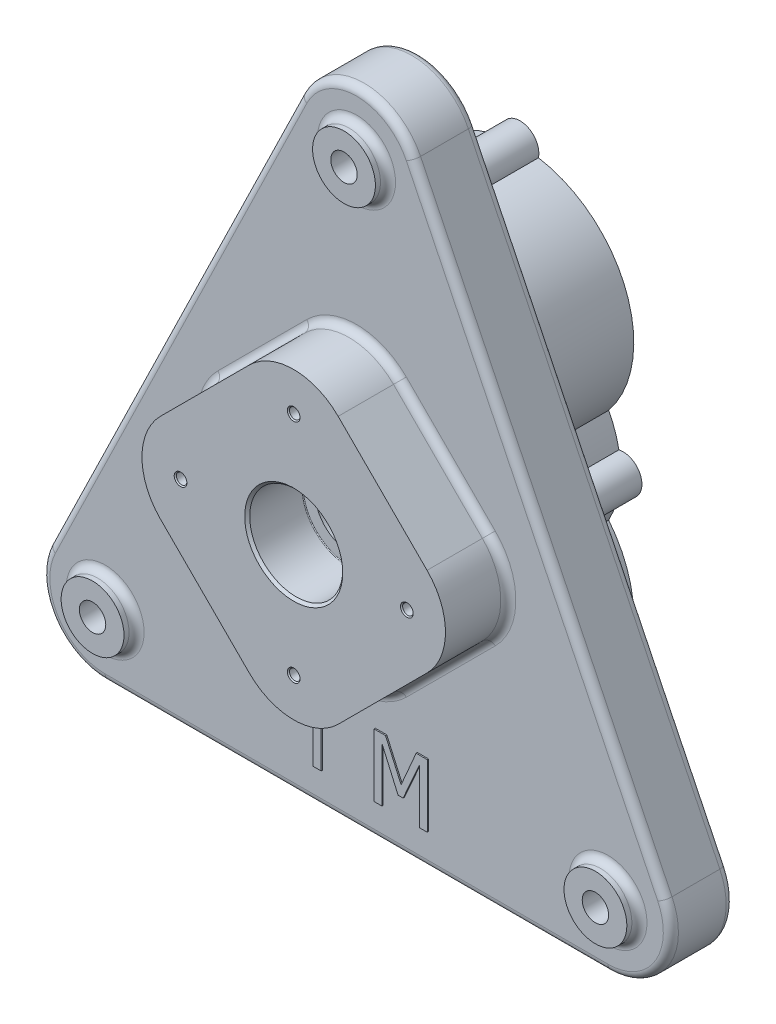
from build123d import *

# Parameters (mm, degrees)
SKETCH1_R                       = 12.5
SKETCH1_R_2                     = 13.5
SKETCH1_R_3                     = 5.25
BOSS_EXTRUDE1_DEPTH             = 25
SKETCH1_3_R                     = 13.5
BOSS_EXTRUDE2_DEPTH             = 50
BOSS_EXTRUDE4_DEPTH             = 40
BOSS_EXTRUDE5_DEPTH             = 35
CUT_EXTRUDE6_START              = -5
SKETCH2_7_R                     = 13.5
CUT_EXTRUDE6_DEPTH              = 5
SKETCH4_R                       = 12
CUT_EXTRUDE7_DEPTH              = 20
SKETCH4_5_R                     = 15
SKETCH4_5_R_2                   = 12
CUT_EXTRUDE8_DEPTH              = 18
SKETCH5_R                       = 18.5
CUT_EXTRUDE9_DEPTH              = 17
CUT_EXTRUDE10_START             = -23
SKETCH5_2_R                     = 18.5
CUT_EXTRUDE10_DEPTH             = 22
FILLET1_R                       = 3
M5X0_8_TAPPED_HOLE1_D           = 4.2
M5X0_8_TAPPED_HOLE1_DEPTH       = 13.7381927
M5X0_8_TAPPED_HOLE1_CSINK_D     = 5.05
M5X0_8_TAPPED_HOLE1_CSINK_ANGLE = 90
M5X0_8_TAPPED_HOLE1_TIP         = 1.2618073
M6X1_0_TAPPED_HOLE1_D           = 5
M6X1_0_TAPPED_HOLE1_DEPTH       = 20.497848452
M6X1_0_TAPPED_HOLE1_CSINK_D     = 6.05
M6X1_0_TAPPED_HOLE1_CSINK_ANGLE = 90
M6X1_0_TAPPED_HOLE1_TIP         = 1.502151548
FILLET3_R                       = 2
CHAMFER1_SIZE                   = 1
BOSS_EXTRUDE6_DEPTH             = 0.5
SKETCH11_R                      = 12.5
SKETCH11_R_2                    = 5.25
BOSS_EXTRUDE7_DEPTH             = 5
FILLET5_R                       = 3
SKETCH12_R                      = 12
CUT_EXTRUDE11_DEPTH             = 0.8
FILLET6_R                       = 3
FILLET7_R                       = 0.3
FILLET8_R                       = 0.3
CHAMFER3_SIZE                   = 1


with BuildPart() as part:
    # Sketch1 → Boss-Extrude1 (new body)
    # profile 1 of 5: a face of its own
    with BuildSketch(Plane.XY):
        with BuildLine():
            Line((-100, -110), (100, -110))
            ThreePointArc((100, -110), (121.201589209, -98.247362567), (122.469211141, -74.039409199))
            Line((122.469211141, -74.039409199), (22.469211141, 130.960590801))
            ThreePointArc((22.469211141, 130.960590801), (0, 145), (-22.469211141, 130.960590801))
            Line((-22.469211141, 130.960590801), (-122.469211141, -74.039409199))
            ThreePointArc((-122.469211141, -74.039409199), (-121.201589209, -98.247362567), (-100, -110))
        make_face()
        with Locations((100, -85)):
            Circle(SKETCH1_R, mode=Mode.SUBTRACT)
        with Locations((-100, -85)):
            Circle(SKETCH1_R, mode=Mode.SUBTRACT)
        with Locations((0, 120)):
            Circle(SKETCH1_R, mode=Mode.SUBTRACT)
        with BuildLine():
            ThreePointArc((17.67766953, 53.033008589), (0, 60.355339059), (-17.67766953, 53.033008589))
            Line((-17.67766953, 53.033008589), (-53.033008589, 17.67766953))
            ThreePointArc((-53.033008589, 17.67766953), (-60.355339059, 0), (-53.033008589, -17.67766953))
            Line((-53.033008589, -17.67766953), (-17.67766953, -53.033008589))
            ThreePointArc((-17.67766953, -53.033008589), (0, -60.355339059), (17.67766953, -53.033008589))
            Line((17.67766953, -53.033008589), (53.033008589, -17.67766953))
            ThreePointArc((53.033008589, -17.67766953), (60.355339059, 0), (53.033008589, 17.67766953))
            Line((53.033008589, 17.67766953), (17.67766953, 53.033008589))
        make_face(mode=Mode.SUBTRACT)
    # profile 2 of 5: a face of its own
    with BuildSketch(Plane.XY):
        with BuildLine():
            Line((53.033008589, 17.67766953), (17.67766953, 53.033008589))
            ThreePointArc((17.67766953, 53.033008589), (0, 60.355339059), (-17.67766953, 53.033008589))
            Line((-17.67766953, 53.033008589), (-53.033008589, 17.67766953))
            ThreePointArc((-53.033008589, 17.67766953), (-60.355339059, 0), (-53.033008589, -17.67766953))
            Line((-53.033008589, -17.67766953), (-17.67766953, -53.033008589))
            ThreePointArc((-17.67766953, -53.033008589), (0, -60.355339059), (17.67766953, -53.033008589))
            Line((17.67766953, -53.033008589), (53.033008589, -17.67766953))
            ThreePointArc((53.033008589, -17.67766953), (60.355339059, 0), (53.033008589, 17.67766953))
        make_face()
        Circle(SKETCH1_R_2, mode=Mode.SUBTRACT)
    # profile 3 of 5: a face of its own
    with BuildSketch(Plane.XY):
        with Locations((100, -85)):
            Circle(SKETCH1_R)
        with Locations((100, -85)):
            Circle(SKETCH1_R_3, mode=Mode.SUBTRACT)
    # profile 4 of 5: a face of its own
    with BuildSketch(Plane.XY):
        with Locations((0, 120)):
            Circle(SKETCH1_R)
        with Locations((0, 120)):
            Circle(SKETCH1_R_3, mode=Mode.SUBTRACT)
    # profile 5 of 5: a face of its own
    with BuildSketch(Plane.XY):
        with Locations((-100, -85)):
            Circle(SKETCH1_R)
        with Locations((-100, -85)):
            Circle(SKETCH1_R_3, mode=Mode.SUBTRACT)
    extrude(amount=BOSS_EXTRUDE1_DEPTH)

    # Sketch1<3> → Boss-Extrude2 (add)
    with BuildSketch(Plane.XY):
        with BuildLine():
            Line((53.033008589, 17.67766953), (17.67766953, 53.033008589))
            ThreePointArc((17.67766953, 53.033008589), (0, 60.355339059), (-17.67766953, 53.033008589))
            Line((-17.67766953, 53.033008589), (-53.033008589, 17.67766953))
            ThreePointArc((-53.033008589, 17.67766953), (-60.355339059, 0), (-53.033008589, -17.67766953))
            Line((-53.033008589, -17.67766953), (-17.67766953, -53.033008589))
            ThreePointArc((-17.67766953, -53.033008589), (0, -60.355339059), (17.67766953, -53.033008589))
            Line((17.67766953, -53.033008589), (53.033008589, -17.67766953))
            ThreePointArc((53.033008589, -17.67766953), (60.355339059, 0), (53.033008589, 17.67766953))
        make_face()
        Circle(SKETCH1_3_R, mode=Mode.SUBTRACT)
    extrude(amount=BOSS_EXTRUDE2_DEPTH)

    # Sketch2 → Boss-Extrude4 (add)
    with BuildSketch(Plane(origin=(0, 0, 0), x_dir=(-1, 0, 0), z_dir=(0, 0, -1))):
        with BuildLine():
            ThreePointArc((39.326219512, 7.310845292), (48.5, 0), (39.326219512, -7.310845292))
            ThreePointArc((39.326219512, -7.310845292), (37.73934661, -13.256761197), (35.25918145, -18.888888889))
            ThreePointArc((35.25918145, -18.888888889), (42.263103155, -63.417640882), (7.327935681, -91.902702703))
            ThreePointArc((7.327935681, -91.902702703), (0, -101), (-7.327935681, -91.902702703))
            ThreePointArc((-7.327935681, -91.902702703), (-42.263103155, -63.417640882), (-35.25918145, -18.888888889))
            ThreePointArc((-35.25918145, -18.888888889), (-37.73934661, -13.256761197), (-39.326219512, -7.310845292))
            ThreePointArc((-39.326219512, -7.310845292), (-48.5, 0), (-39.326219512, 7.310845292))
            ThreePointArc((-39.326219512, 7.310845292), (-37.73934661, 13.256761197), (-35.25918145, 18.888888889))
            ThreePointArc((-35.25918145, 18.888888889), (-42.263103155, 63.417640882), (-7.327935681, 91.902702703))
            ThreePointArc((-7.327935681, 91.902702703), (0, 101), (7.327935681, 91.902702703))
            ThreePointArc((7.327935681, 91.902702703), (42.263103155, 63.417640882), (35.25918145, 18.888888889))
            ThreePointArc((35.25918145, 18.888888889), (37.73934661, 13.256761197), (39.326219512, 7.310845292))
        make_face()
        with BuildLine():
            ThreePointArc((-33.634026941, 25.14084507), (-31.560284169, 19.279235577), (-32.445868381, 13.125))
            ThreePointArc((-32.445868381, 13.125), (-35, 0), (-32.445868381, -13.125))
            ThreePointArc((-32.445868381, -13.125), (-31.560284169, -19.279235577), (-33.634026941, -25.14084507))
            ThreePointArc((-33.634026941, -25.14084507), (0, -87.5), (33.634026941, -25.14084507))
            ThreePointArc((33.634026941, -25.14084507), (31.560284169, -19.279235577), (32.445868381, -13.125))
            ThreePointArc((32.445868381, -13.125), (35, 0), (32.445868381, 13.125))
            ThreePointArc((32.445868381, 13.125), (31.560284169, 19.279235577), (33.634026941, 25.14084507))
            ThreePointArc((33.634026941, 25.14084507), (0, 87.5), (-33.634026941, 25.14084507))
        make_face(mode=Mode.SUBTRACT)
    extrude(amount=BOSS_EXTRUDE4_DEPTH)

    # Sketch2<6> → Boss-Extrude5 (add)
    with BuildSketch(Plane(origin=(0, 0, 0), x_dir=(-1, 0, 0), z_dir=(0, 0, -1))):
        with BuildLine():
            ThreePointArc((33.634026941, 25.14084507), (0, 87.5), (-33.634026941, 25.14084507))
            ThreePointArc((-33.634026941, 25.14084507), (-31.560284169, 19.279235577), (-32.445868381, 13.125))
            ThreePointArc((-32.445868381, 13.125), (-35, 0), (-32.445868381, -13.125))
            ThreePointArc((-32.445868381, -13.125), (-31.560284169, -19.279235577), (-33.634026941, -25.14084507))
            ThreePointArc((-33.634026941, -25.14084507), (0, -87.5), (33.634026941, -25.14084507))
            ThreePointArc((33.634026941, -25.14084507), (31.560284169, -19.279235577), (32.445868381, -13.125))
            ThreePointArc((32.445868381, -13.125), (35, 0), (32.445868381, 13.125))
            ThreePointArc((32.445868381, 13.125), (31.560284169, 19.279235577), (33.634026941, 25.14084507))
        make_face()
        with BuildLine():
            ThreePointArc((-29.402979588, 26.047941342), (-27.007468125, 19.69170868), (-28.144827014, 12.994949495))
            ThreePointArc((-28.144827014, 12.994949495), (-31, 0), (-28.144827014, -12.994949495))
            ThreePointArc((-28.144827014, -12.994949495), (-27.007468125, -19.69170868), (-29.402979588, -26.047941342))
            ThreePointArc((-29.402979588, -26.047941342), (0, -83.5), (29.402979588, -26.047941342))
            ThreePointArc((29.402979588, -26.047941342), (27.007468125, -19.69170868), (28.144827014, -12.994949495))
            ThreePointArc((28.144827014, -12.994949495), (31, 0), (28.144827014, 12.994949495))
            ThreePointArc((28.144827014, 12.994949495), (27.007468125, 19.69170868), (29.402979588, 26.047941342))
            ThreePointArc((29.402979588, 26.047941342), (0, 83.5), (-29.402979588, 26.047941342))
        make_face(mode=Mode.SUBTRACT)
    extrude(amount=BOSS_EXTRUDE5_DEPTH)

    # Sketch2<7> → Cut-Extrude6 (cut)
    with BuildSketch(Plane(origin=(0, 0, 0), x_dir=(-1, 0, 0), z_dir=(0, 0, -1)).offset(CUT_EXTRUDE6_START)):
        with BuildLine():
            ThreePointArc((29.402979588, 26.047941342), (0, 83.5), (-29.402979588, 26.047941342))
            ThreePointArc((-29.402979588, 26.047941342), (-27.007468125, 19.69170868), (-28.144827014, 12.994949495))
            ThreePointArc((-28.144827014, 12.994949495), (-31, 0), (-28.144827014, -12.994949495))
            ThreePointArc((-28.144827014, -12.994949495), (-27.007468125, -19.69170868), (-29.402979588, -26.047941342))
            ThreePointArc((-29.402979588, -26.047941342), (0, -83.5), (29.402979588, -26.047941342))
            ThreePointArc((29.402979588, -26.047941342), (27.007468125, -19.69170868), (28.144827014, -12.994949495))
            ThreePointArc((28.144827014, -12.994949495), (31, 0), (28.144827014, 12.994949495))
            ThreePointArc((28.144827014, 12.994949495), (27.007468125, 19.69170868), (29.402979588, 26.047941342))
        make_face()
        Circle(SKETCH2_7_R, mode=Mode.SUBTRACT)
    extrude(amount=CUT_EXTRUDE6_DEPTH, mode=Mode.SUBTRACT)

    # Sketch4 → Cut-Extrude7 (cut)
    with BuildSketch(Plane(origin=(0, 0, 0), x_dir=(-1, 0, 0), z_dir=(0, 0, -1))):
        with Locations((0, -47.25)):
            Circle(SKETCH4_R)
        with Locations((0, 47.25)):
            Circle(SKETCH4_R)
    extrude(amount=-CUT_EXTRUDE7_DEPTH, mode=Mode.SUBTRACT)

    # Sketch4<5> → Cut-Extrude8 (cut)
    # profile 1 of 2: a face of its own
    with BuildSketch(Plane(origin=(0, 0, 0), x_dir=(-1, 0, 0), z_dir=(0, 0, -1))):
        with Locations((0, 47.25)):
            Circle(SKETCH4_5_R)
        with Locations((0, 47.25)):
            Circle(SKETCH4_5_R_2, mode=Mode.SUBTRACT)
    # profile 2 of 2: a face of its own
    with BuildSketch(Plane(origin=(0, 0, 0), x_dir=(-1, 0, 0), z_dir=(0, 0, -1))):
        with Locations((0, -47.25)):
            Circle(SKETCH4_5_R)
        with Locations((0, -47.25)):
            Circle(SKETCH4_5_R_2, mode=Mode.SUBTRACT)
    extrude(amount=-CUT_EXTRUDE8_DEPTH, mode=Mode.SUBTRACT)

    # Sketch5 → Cut-Extrude9 (cut)
    with BuildSketch(Plane(origin=(0, 0, 5), x_dir=(-1, 0, 0), z_dir=(0, 0, -1))):
        Circle(SKETCH5_R)
    extrude(amount=-CUT_EXTRUDE9_DEPTH, mode=Mode.SUBTRACT)

    # Sketch5<2> → Cut-Extrude10 (cut)
    with BuildSketch(Plane(origin=(0, 0, 5), x_dir=(-1, 0, 0), z_dir=(0, 0, -1)).offset(CUT_EXTRUDE10_START)):
        Circle(SKETCH5_2_R)
    extrude(amount=-CUT_EXTRUDE10_DEPTH, mode=Mode.SUBTRACT)

    # Fillet1
    fillet1_edges = [part.edges().sort_by_distance(p)[0] for p in [
        (121.201589209, -98.247362567, 25),
        (-121.201589209, -98.247362567, 0),
        (-72.469211141, 28.460590801, 0),
        (0, 145, 0),
        (72.469211141, 28.460590801, 0),
        (121.201589209, -98.247362567, 0),
        (0, -110, 0),
        (0, 83.5, 5),
        (-31, 0, 5),
        (-27.007468125, -19.69170868, 5),
        (31, 0, 5),
        (27.007468125, 19.69170868, 5),
        (-27.007468125, 19.69170868, 5),
        (0, -83.5, 5),
        (27.007468125, -19.69170868, 5),
        (72.469211141, 28.460590801, 25),
        (0, 145, 25),
        (-72.469211141, 28.460590801, 25),
        (-121.201589209, -98.247362567, 25),
        (35.355339059, 35.355339059, 25),
        (0, 60.355339059, 25),
        (-35.355339059, 35.355339059, 25),
        (-60.355339059, 0, 25),
        (-35.355339059, -35.355339059, 25),
        (0, -60.355339059, 25),
        (35.355339059, -35.355339059, 25),
        (60.355339059, 0, 25),
        (0, -110, 25),
    ]]
    fillet(fillet1_edges, radius=FILLET1_R)

    # M5x0.8 Tapped Hole1
    with Locations(Plane(origin=(0, 45, 50), x_dir=(1, 0, 0), z_dir=(0, 0, 1))):
        with Locations((0, 0), (-45, -45), (45, -45), (0, -90)):
            CounterSinkHole(M5X0_8_TAPPED_HOLE1_D / 2, M5X0_8_TAPPED_HOLE1_CSINK_D / 2, depth=M5X0_8_TAPPED_HOLE1_DEPTH, counter_sink_angle=M5X0_8_TAPPED_HOLE1_CSINK_ANGLE)
            with Locations((0, 0, -(M5X0_8_TAPPED_HOLE1_DEPTH + M5X0_8_TAPPED_HOLE1_TIP / 2))):  # 118° drill point
                Cone(0, M5X0_8_TAPPED_HOLE1_D / 2, M5X0_8_TAPPED_HOLE1_TIP, mode=Mode.SUBTRACT)

    # M6x1.0 Tapped Hole1
    with Locations(Plane(origin=(0, 93.5, -40), x_dir=(-1, 0, 0), z_dir=(0, 0, -1))):
        with Locations((0, 0), (41, -93.5), (-41, -93.5), (0, -187)):
            CounterSinkHole(M6X1_0_TAPPED_HOLE1_D / 2, M6X1_0_TAPPED_HOLE1_CSINK_D / 2, depth=M6X1_0_TAPPED_HOLE1_DEPTH, counter_sink_angle=M6X1_0_TAPPED_HOLE1_CSINK_ANGLE)
            with Locations((0, 0, -(M6X1_0_TAPPED_HOLE1_DEPTH + M6X1_0_TAPPED_HOLE1_TIP / 2))):  # 118° drill point
                Cone(0, M6X1_0_TAPPED_HOLE1_D / 2, M6X1_0_TAPPED_HOLE1_TIP, mode=Mode.SUBTRACT)

    # Fillet3
    fillet3_edges = [part.edges().sort_by_distance(p)[0] for p in [
        (-37.73934661, 13.256761197, 0),
        (-42.263103155, 63.417640882, 0),
        (0, 101, 0),
        (42.263103155, 63.417640882, 0),
        (37.73934661, 13.256761197, 0),
        (48.5, 0, 0),
        (37.73934661, -13.256761197, 0),
        (-37.73934661, -13.256761197, 0),
        (-48.5, 0, 0),
        (-42.263103155, -63.417640882, 0),
        (0, -101, 0),
        (42.263103155, -63.417640882, 0),
    ]]
    fillet(fillet3_edges, radius=FILLET3_R)

    # Chamfer1
    chamfer1_edges = [part.edges().sort_by_distance(p)[0] for p in [
        (15, 47.25, 5),
        (15, -47.25, 5),
        (18.5, 0, 5),
        (18.5, 0, 50),
    ]]
    chamfer(chamfer1_edges, length=CHAMFER1_SIZE)

    # Sketch10 → Boss-Extrude6 (add)
    with BuildSketch(Plane.XY.offset(25)):
        Polygon((-16.772151899, -97), (-16.772151899, -74.848101266), (-25.632911392, -74.848101266), (-25.632911392, -72), (-4.746835443, -72), (-4.746835443, -74.848101266), (-13.607594937, -74.848101266), (-13.607594937, -97), align=None)
        Polygon((28.639240506, -97), (25.474683544, -97), (25.474683544, -75.441455696), (19.012064873, -90.037974684), (17.014438291, -90.037974684), (10.601265823, -75.441455696), (10.601265823, -97), (7.436708861, -97), (7.436708861, -72), (12.015427215, -72), (18.211036392, -85.85977057), (24.194026899, -72), (28.639240506, -72), align=None)
    extrude(amount=BOSS_EXTRUDE6_DEPTH)

    # Sketch11 → Boss-Extrude7 (add)
    # profile 1 of 3: a face of its own
    with BuildSketch(Plane.XY.offset(25)):
        with Locations((0, 120)):
            Circle(SKETCH11_R)
        with Locations((0, 120)):
            Circle(SKETCH11_R_2, mode=Mode.SUBTRACT)
    # profile 2 of 3: a face of its own
    with BuildSketch(Plane.XY.offset(25)):
        with Locations((100, -85)):
            Circle(SKETCH11_R)
        with Locations((100, -85)):
            Circle(SKETCH11_R_2, mode=Mode.SUBTRACT)
    # profile 3 of 3: a face of its own
    with BuildSketch(Plane.XY.offset(25)):
        with Locations((-100, -85)):
            Circle(SKETCH11_R)
        with Locations((-100, -85)):
            Circle(SKETCH11_R_2, mode=Mode.SUBTRACT)
    extrude(amount=BOSS_EXTRUDE7_DEPTH)

    # Fillet5
    fillet5_edges = [part.edges().sort_by_distance(p)[0] for p in [
        (-12.5, 120, 25),
        (87.5, -85, 25),
        (-112.5, -85, 25),
    ]]
    fillet(fillet5_edges, radius=FILLET5_R)

    # Sketch12 → Cut-Extrude11 (cut)
    with BuildSketch(Plane(origin=(0, 0, 0), x_dir=(-1, 0, 0), z_dir=(0, 0, -1))):
        with Locations((0, 120)):
            Circle(SKETCH12_R)
        with Locations((100, -85)):
            Circle(SKETCH12_R)
        with Locations((-100, -85)):
            Circle(SKETCH12_R)
    extrude(amount=-CUT_EXTRUDE11_DEPTH, mode=Mode.SUBTRACT)

    # Fillet6
    # the kernel refuses this fillet: 3 mm, written as the material it adds along each edge
    with BuildSketch(Plane(origin=(0, -47.25, 20), x_dir=(-1, 0, 0), z_dir=(0, -1, 0))) as fillet6_piece_1:
        with BuildLine():
            CenterArc((9.171572875, 3), FILLET6_R, 270, 70.528779366)
            Line((9.171572875, 0), (9.171572875, -0.06))
            Line((9.171572875, -0.06), (12, -0.06))
            Line((12, -0.06), (12.06, 0))
            ThreePointArc((12.06, 0), (12.06, 1), (12.056568542, 1.98))
            Line((12.056568542, 1.98), (12, 2))
        make_face()
    revolve(axis=Axis((0, -47.25, 20), (0, 0, -1)))
    with BuildSketch(Plane(origin=(0, 47.25, 20), x_dir=(-1, 0, 0), z_dir=(0, -1, 0))) as fillet6_piece_2:
        with BuildLine():
            CenterArc((9.171572875, 3), FILLET6_R, 270, 70.528779366)
            Line((9.171572875, 0), (9.171572875, -0.06))
            Line((9.171572875, -0.06), (12, -0.06))
            Line((12, -0.06), (12.06, 0))
            ThreePointArc((12.06, 0), (12.06, 1), (12.056568542, 1.98))
            Line((12.056568542, 1.98), (12, 2))
        make_face()
    revolve(axis=Axis((0, 47.25, 20), (0, 0, -1)))

    # Fillet7
    fillet7_edges = [part.edges().sort_by_distance(p)[0] for p in [
        (15, 47.25, 18),
        (15, -47.25, 18),
    ]]
    fillet(fillet7_edges, radius=FILLET7_R)

    # Fillet8
    fillet8_edges = [part.edges().sort_by_distance(p)[0] for p in [
        (18.5, 0, 22),
        (18.5, 0, 28),
    ]]
    fillet(fillet8_edges, radius=FILLET8_R)

    # Chamfer3
    # the kernel refuses this chamfer: 1 mm, written as the material it adds along each edge
    with BuildSketch(Plane(origin=(100, -85, 0.8), x_dir=(-1, 0, 0), z_dir=(0, -1, 0))) as chamfer3_piece_1_section:
        Polygon((12, CHAMFER3_SIZE), (12 - CHAMFER3_SIZE, 0), (12, 0), align=None)
    chamfer3_piece_1 = revolve(axis=Axis((100, -85, 0.8), (0, 0, -1)), mode=Mode.PRIVATE)
    chamfer3_piece_1 = split(chamfer3_piece_1, bisect_by=Plane(origin=(111.409670244, -85, 0), z_dir=(0, 0, 1)), keep=Keep.TOP, mode=Mode.PRIVATE)
    add(chamfer3_piece_1)
    with BuildSketch(Plane(origin=(-100, -85, 0.8), x_dir=(-1, 0, 0), z_dir=(0, -1, 0))) as chamfer3_piece_2_section:
        Polygon((12, CHAMFER3_SIZE), (12 - CHAMFER3_SIZE, 0), (12, 0), align=None)
    chamfer3_piece_2 = revolve(axis=Axis((-100, -85, 0.8), (0, 0, -1)), mode=Mode.PRIVATE)
    chamfer3_piece_2 = split(chamfer3_piece_2, bisect_by=Plane(origin=(-88.590329756, -85, 0), z_dir=(0, 0, 1)), keep=Keep.TOP, mode=Mode.PRIVATE)
    add(chamfer3_piece_2)
    with BuildSketch(Plane(origin=(0, 120, 0.8), x_dir=(-1, 0, 0), z_dir=(0, -1, 0))) as chamfer3_piece_3_section:
        Polygon((12, CHAMFER3_SIZE), (12 - CHAMFER3_SIZE, 0), (12, 0), align=None)
    chamfer3_piece_3 = revolve(axis=Axis((0, 120, 0.8), (0, 0, -1)), mode=Mode.PRIVATE)
    chamfer3_piece_3 = split(chamfer3_piece_3, bisect_by=Plane(origin=(11.409670244, 120, 0), z_dir=(0, 0, 1)), keep=Keep.TOP, mode=Mode.PRIVATE)
    add(chamfer3_piece_3)


solid = part.part
